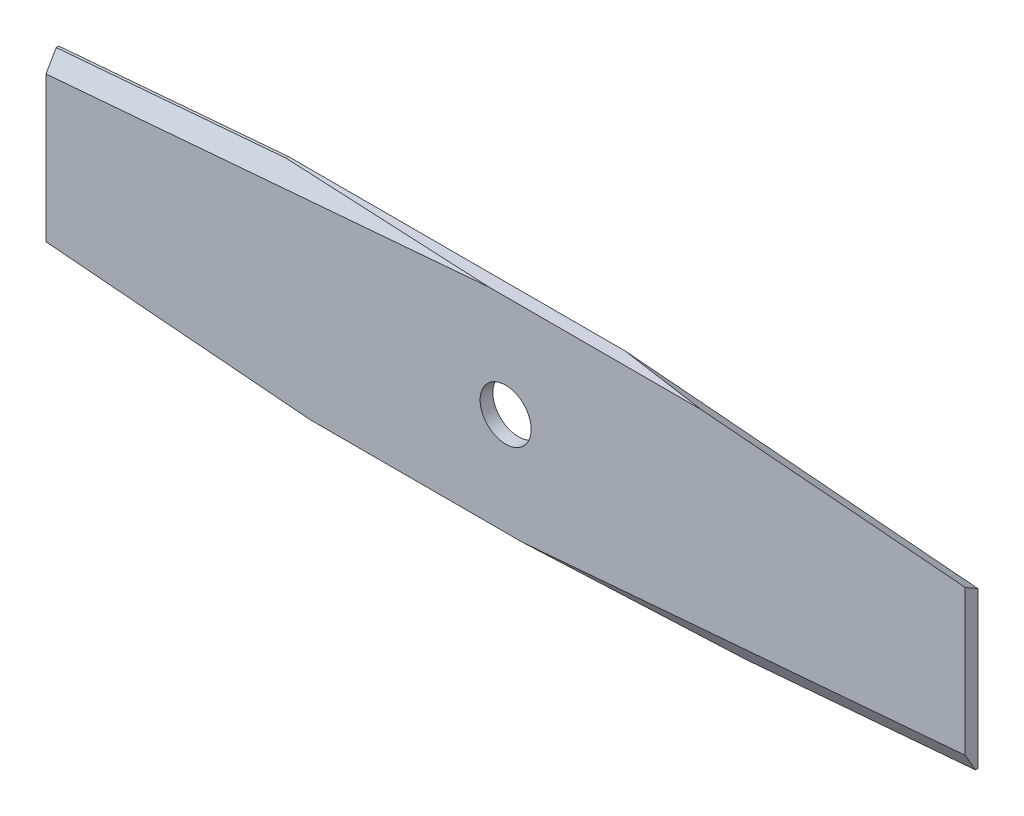
from build123d import *

# Parameters (mm, degrees)
BOSS_EXTRUDE1_DEPTH = 3.175
SKETCH2_R           = 6.35
CUT_EXTRUDE1_DEPTH  = 118.131253835
CHAMFER1_SIZE       = 4.399409051
CHAMFER1_SIZE_2     = 2.54


with BuildPart() as part:
    # Sketch1 → Boss-Extrude1 (new body)
    with BuildSketch(Plane.XY):
        Polygon((-57.15, 25.4), (57.15, 25.4), (114.3, 20.6375), (114.3, -20.6375), (57.15, -25.4), (-57.15, -25.4), (-114.3, -20.6375), (-114.3, 20.6375), align=None)
    extrude(amount=BOSS_EXTRUDE1_DEPTH)

    # Sketch2 → Cut-Extrude1 (cut, through all)
    with BuildSketch(Plane.XY.offset(3.175)):
        Circle(SKETCH2_R)
    extrude(amount=-CUT_EXTRUDE1_DEPTH, mode=Mode.SUBTRACT)

    # Chamfer1
    # the kernel refuses this chamfer: 4.399409051, 2.54 mm, written as the material it takes off along each edge
    with BuildSketch(Plane(origin=(23.12299944, 28.23558338, 0), x_dir=(0, 0, 1), z_dir=(0.9965457582448797, -0.0830454798537405, 0))) as chamfer1_piece_1:
        Polygon((CHAMFER1_SIZE, 0), (0, CHAMFER1_SIZE_2), (0, 0), align=None)
    extrude(amount=102.874688123, mode=Mode.SUBTRACT)
    with BuildSketch(Plane(origin=(-23.12299944, -28.23558338, 0), x_dir=(0.0830454798537407, 0.9965457582448796, 0), z_dir=(-0.9965457582448797, 0.08304547985374071, 0))) as chamfer1_piece_2:
        Polygon((CHAMFER1_SIZE_2, 0), (0, -CHAMFER1_SIZE), (0, 0), align=None)
    extrude(amount=102.874688123, mode=Mode.SUBTRACT)
    with BuildSketch(Plane(origin=(-125.64233352, 19.69230554, 3.175), x_dir=(0, 0, -1), z_dir=(0.9965457582448797, 0.08304547985374024, 0))) as chamfer1_piece_3:
        Polygon((CHAMFER1_SIZE_2, 0), (0, -CHAMFER1_SIZE), (0, 0), align=None)
    extrude(amount=125.637985093, mode=Mode.SUBTRACT)
    with BuildSketch(Plane(origin=(125.64233352, -19.69230554, 3.175), x_dir=(-0.08304547985374047, 0.9965457582448795, 0), z_dir=(-0.9965457582448797, -0.0830454798537405, 0))) as chamfer1_piece_4:
        Polygon((CHAMFER1_SIZE, 0), (0, CHAMFER1_SIZE_2), (0, 0), align=None)
    extrude(amount=125.637985093, mode=Mode.SUBTRACT)


solid = part.part
